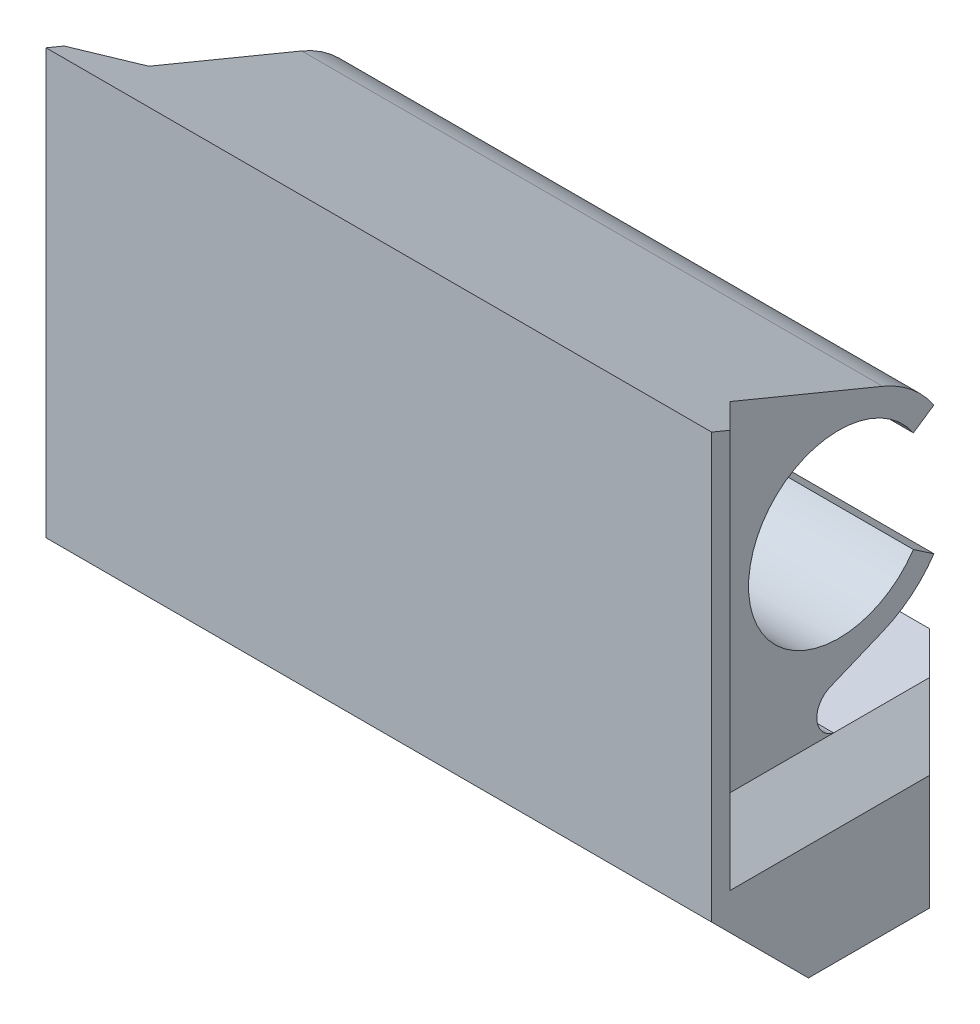
from build123d import *

# Parameters (mm, degrees)
SKETCH1_W           = 55
SKETCH1_H           = 45
BOSS_EXTRUDE1_DEPTH = 5
SKETCH3_W           = 55
SKETCH3_H           = 13
BOSS_EXTRUDE5_DEPTH = 20
CHAMFER1_SIZE       = 8
SKETCH5_R           = 4.5
CUT_EXTRUDE2_DEPTH  = 8
BOSS_EXTRUDE7_DEPTH = 48
CUT_EXTRUDE3_DEPTH  = 71.205777697
CHAMFER2_SIZE       = 3.5
CHAMFER3_SIZE       = 3.5
CHAMFER4_SIZE       = 7


with BuildPart() as part:
    # Sketch1 → Boss-Extrude1 (new body)
    with BuildSketch(Plane.XY):
        with Locations((17.145774036, 16.279520652)):
            Rectangle(SKETCH1_W, SKETCH1_H)
    extrude(amount=BOSS_EXTRUDE1_DEPTH)

    # Sketch3 → Boss-Extrude5 (add)
    with BuildSketch(Plane(origin=(0, 0, 0), x_dir=(-1, 0, 0), z_dir=(0, 0, -1))):
        with Locations((-17.145774036, 0.279520652)):
            Rectangle(SKETCH3_W, SKETCH3_H)
    extrude(amount=BOSS_EXTRUDE5_DEPTH)

    # Chamfer1
    chamfer1_edges = [part.edges().sort_by_distance(p)[0] for p in [
        (17.145774036, -6.220479348, 5),
    ]]
    chamfer(chamfer1_edges, length=CHAMFER1_SIZE)

    # Sketch5 → Cut-Extrude2 (cut)
    with BuildSketch(Plane.XZ.offset(6.220479348)):
        with Locations(Location((-0.354225964, -11, 0), (0, 0, 270))):
            Circle(SKETCH5_R)
        with Locations(Location((34.645774036, -11, 0), (0, 0, 270))):
            Circle(SKETCH5_R)
    extrude(amount=-CUT_EXTRUDE2_DEPTH, mode=Mode.SUBTRACT)

    # Sketch7 → Boss-Extrude7 (add)
    with BuildSketch(Plane.ZY.offset(6.854225964)):
        with BuildLine():
            Line((-8.308177677, 10.21387745), (-12.629175087, 12.000050953))
            ThreePointArc((-12.629175087, 12.000050953), (-15.003318067, 13.416764905), (-16.86901604, 15.457060078))
            Line((-16.86901604, 15.457060078), (-15.17096521, 16.605591044))
            ThreePointArc((-15.17096521, 16.605591044), (-1.55, 20.779520652), (-15.17096521, 24.95345026))
            Line((-15.17096521, 24.95345026), (-16.86901604, 26.101981226))
            ThreePointArc((-16.86901604, 26.101981226), (-15.003318067, 28.142276398), (-12.629175087, 29.55899035))
            Line((-12.629175087, 29.55899035), (0, 34.779520652))
            Line((0, 34.779520652), (0, 6.779520652))
            Line((0, 6.779520652), (-8.576470695, 6.779520652))
            ThreePointArc((-8.576470695, 6.779520652), (-7.194534972, 8.39922137), (-8.308177677, 10.21387745))
        make_face()
    extrude(amount=-BOSS_EXTRUDE7_DEPTH)

    # Sketch8 → Cut-Extrude3 (cut, through all)
    with BuildSketch(Plane.ZY.offset(10.354225964)):
        Polygon((0, 34.779520652), (5, 36.846373896), (5, 38.779520652), (0, 38.779520652), align=None)
    extrude(amount=-CUT_EXTRUDE3_DEPTH, mode=Mode.SUBTRACT)

    # Chamfer2
    chamfer2_edges = [part.edges().sort_by_distance(p)[0] for p in [
        (-10.354225964, 6.779520652, -10),
        (-10.354225964, 20.779520652, 0),
    ]]
    chamfer(chamfer2_edges, length=CHAMFER2_SIZE - 0.0001)  # a hair under: the kernel refuses the full size

    # Chamfer3
    chamfer3_edges = [part.edges().sort_by_distance(p)[0] for p in [
        (44.645774036, 20.779520652, 0),
        (44.645774036, 6.779520652, -10),
    ]]
    chamfer(chamfer3_edges, length=CHAMFER3_SIZE - 0.0001)  # a hair under: the kernel refuses the full size

    # Chamfer4
    chamfer4_edges = [part.edges().sort_by_distance(p)[0] for p in [
        (44.645774036, -1.470429348, -20),
        (-10.354225964, -1.470429348, -20),
    ]]
    chamfer(chamfer4_edges, length=CHAMFER4_SIZE)


solid = part.part
